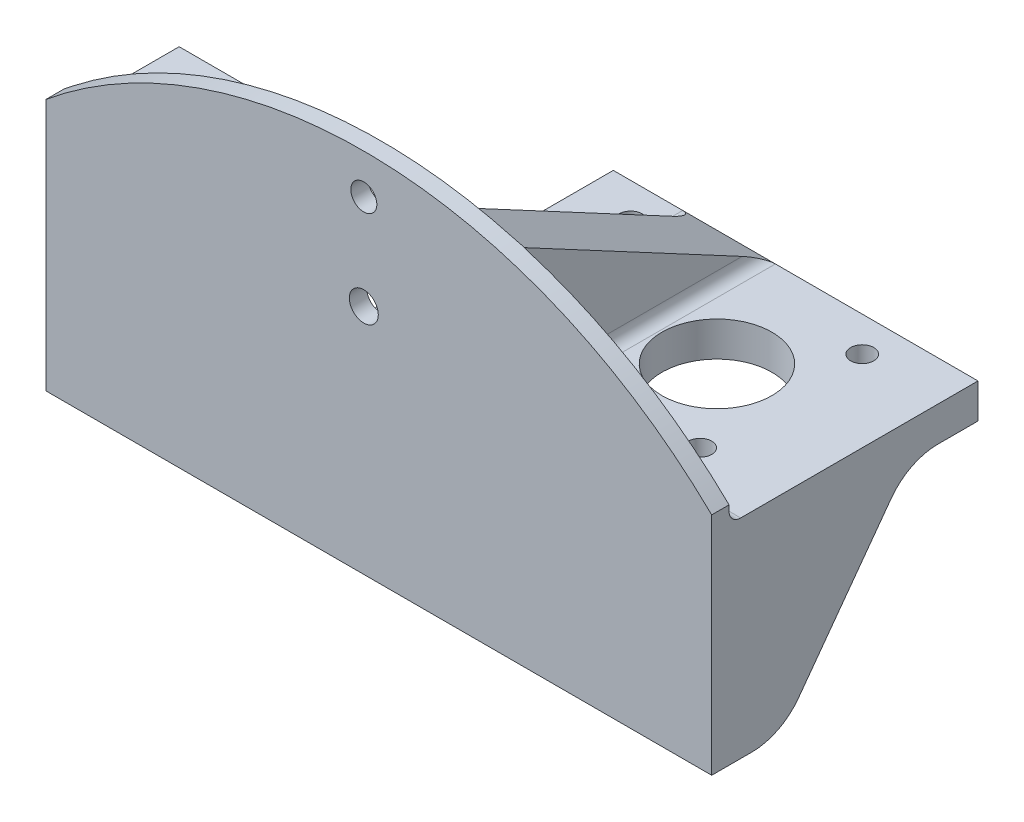
from build123d import *

# Parameters (mm, degrees)
SKETCH2_W                      = 58
SKETCH2_H                      = 40
SKETCH2_R                      = 2
SKETCH2_R_2                    = 9.5
BOSS_EXTRUDE1_DEPTH            = 6
BOSS_EXTRUDE2_DEPTH            = 6
BOSS_EXTRUDE2_DEPTH_BACK       = 30
SKETCH3_W                      = 58
SKETCH3_H                      = 3
BOSS_EXTRUDE4_DEPTH            = 39
BOSS_EXTRUDE4_DEPTH_BACK       = 30
SKETCH7_W                      = 115
SKETCH7_H                      = 3
CUT_EXTRUDE1_DEPTH             = 94.584186698
SKETCH5_R                      = 2.25
SKETCH5_R_2                    = 2.5
CUT_EXTRUDE2_DEPTH             = 92.374080023
BOSS_EXTRUDE3_DEPTH            = 10
BOSS_EXTRUDE3_DEPTH_BACK       = 2
SKETCH8_W                      = 25
SKETCH8_H                      = 40
BOSS_EXTRUDE5_DEPTH            = 20
SKETCH9_R                      = 15.499999921
CUT_EXTRUDE3_DEPTH             = 80.228924642
BOSS_EXTRUDE6_DEPTH            = 5
FILLET2_R                      = 5
CUT_EXTRUDE4_REACH             = 93.374
SKETCH12_W                     = 2
SKETCH12_H                     = 30
CUT_EXTRUDE4_DIRECTION_2_DEPTH = 92.374080176
FILLET1_R                      = 2
FILLET3_R                      = 10


with BuildPart() as part:
    # Sketch2 → Boss-Extrude1 (new body)
    with BuildSketch(Plane(origin=(0, 0, 0), x_dir=(1, 0, 0), z_dir=(0, 1, 0))):
        Rectangle(SKETCH2_W, SKETCH2_H)
        with Locations(Location((-20, 14, 0), (0, 0, 270))):
            Circle(SKETCH2_R, mode=Mode.SUBTRACT)
        with Locations(Location((20, 14, 0), (0, 0, 270))):
            Circle(SKETCH2_R, mode=Mode.SUBTRACT)
        with Locations(Location((20, -14, 0), (0, 0, 270))):
            Circle(SKETCH2_R, mode=Mode.SUBTRACT)
        with Locations(Location((-20, -14, 0), (0, 0, 270))):
            Circle(SKETCH2_R, mode=Mode.SUBTRACT)
        with Locations(Location((8.9, 0, 0), (0, 0, 270))):
            Circle(SKETCH2_R_2, mode=Mode.SUBTRACT)
    extrude(amount=BOSS_EXTRUDE1_DEPTH)

    # Sketch3 → Boss-Extrude2 (add, two sides: drawn at the far end of the back side and taken through both)
    with BuildSketch(Plane(origin=(0, 0, 0), x_dir=(1, 0, 0), z_dir=(0, 1, 0)).offset(-BOSS_EXTRUDE2_DEPTH_BACK)):
        with Locations((0, -21.5)):
            Rectangle(SKETCH3_W, SKETCH3_H)
    extrude(amount=BOSS_EXTRUDE2_DEPTH + BOSS_EXTRUDE2_DEPTH_BACK)

    # Sketch7 → Boss-Extrude4 (add, two sides: drawn at the far end of the back side and taken through both)
    with BuildSketch(Plane(origin=(0, 0, 0), x_dir=(1, 0, 0), z_dir=(0, 1, 0)).offset(-BOSS_EXTRUDE4_DEPTH_BACK)):
        with Locations((-23.5, -24.5)):
            Rectangle(SKETCH7_W, SKETCH7_H)
    extrude(amount=BOSS_EXTRUDE4_DEPTH + BOSS_EXTRUDE4_DEPTH_BACK)

    # Sketch4 → Cut-Extrude1 (cut, through all)
    with BuildSketch(Plane.XY):
        with BuildLine():
            Line((-81, 13.621067419), (-81, 45.200754785))
            Line((-81, 45.200754785), (34, 45.200754785))
            Line((34, 45.200754785), (34, 8.963176429))
            ThreePointArc((34, 8.963176429), (-22.609442943, 33.279339271), (-81, 13.621067419))
        make_face()
    extrude(amount=CUT_EXTRUDE1_DEPTH, mode=Mode.SUBTRACT)

    # Sketch5 → Cut-Extrude2 (cut, through all)
    with BuildSketch(Plane.XY):
        with Locations(Location((-26.099999185, 26.475, 0), (0, 0, 180))):
            Circle(SKETCH5_R)
        with Locations(Location((-26.099999185, 10.1, 0), (0, 0, 180))):
            Circle(SKETCH5_R_2)
    extrude(amount=CUT_EXTRUDE2_DEPTH, mode=Mode.SUBTRACT)

    # Sketch6 → Boss-Extrude3 (add, two sides: drawn at the far end of the back side and taken through both)
    with BuildSketch(Plane(origin=(-13, 0, 0), x_dir=(0, 0, -1), z_dir=(1, 0, 0)).offset(-BOSS_EXTRUDE3_DEPTH_BACK)):
        Polygon((20, 6), (-23, 29), (-23, 6), align=None)
    extrude(amount=BOSS_EXTRUDE3_DEPTH + BOSS_EXTRUDE3_DEPTH_BACK)

    # Sketch8 → Boss-Extrude5 (add)
    with BuildSketch(Plane(origin=(0, 0, 23), x_dir=(-1, 0, 0), z_dir=(0, 0, -1))):
        with Locations((68.5, -10)):
            Rectangle(SKETCH8_W, SKETCH8_H)
    extrude(amount=BOSS_EXTRUDE5_DEPTH)

    # Sketch9 → Cut-Extrude3 (cut, through all)
    with BuildSketch(Plane(origin=(-33, 0, 0), x_dir=(0, 0, -1), z_dir=(1, 0, 0))):
        with Locations((-2.25e-07, -11)):
            Circle(SKETCH9_R)
    extrude(amount=-CUT_EXTRUDE3_DEPTH, mode=Mode.SUBTRACT)

    # Sketch10 → Boss-Extrude6 (add)
    with BuildSketch(Plane(origin=(29, 0, 0), x_dir=(0, 0, -1), z_dir=(1, 0, 0))):
        Polygon((20, 0), (20, 6), (-26, 6), (-26, -30), (-14, -30), (8, 0), align=None)
    extrude(amount=BOSS_EXTRUDE6_DEPTH)

    # Fillet2
    fillet2_edges = [part.edges().sort_by_distance(p)[0] for p in [
        (-68.5, 10, 23),
        (-56, -10, 23),
    ]]
    fillet(fillet2_edges, radius=FILLET2_R)

    # Cut-Extrude4: up to this face of the body (flat: up to its plane)
    cut_extrude4_end = Plane(part.part.faces().sort_by_distance((0, -15, 20))[0])
    # Sketch12 → Cut-Extrude4 (cut, up to the picked face)
    with BuildSketch(Plane.XY, mode=Mode.PRIVATE) as cut_extrude4_sk1:
        with Locations((30, -15)):
            Rectangle(SKETCH12_W, SKETCH12_H)
    cut_extrude4_tool1 = split(extrude(cut_extrude4_sk1.sketch, amount=CUT_EXTRUDE4_REACH, mode=Mode.PRIVATE), bisect_by=cut_extrude4_end, keep=Keep.BOTH, mode=Mode.PRIVATE)
    add(cut_extrude4_tool1.solids().sort_by(Axis((30, -15, 0), (0, 0, 1)))[0], mode=Mode.SUBTRACT)

    # Sketch12 → Cut-Extrude4 direction 2 (cut)
    with BuildSketch(Plane.XY):
        with Locations((30, -15)):
            Rectangle(SKETCH12_W, SKETCH12_H)
    extrude(amount=-CUT_EXTRUDE4_DIRECTION_2_DEPTH, mode=Mode.SUBTRACT)

    # Fillet1
    # the kernel refuses this fillet: 2 mm, written as the material it adds along each edge
    with BuildSketch(Plane(origin=(-1, 8, 21), x_dir=(-1, 0, 0), z_dir=(0, 0, 1))) as fillet1_piece_1_section:
        Polygon((0, 0), (FILLET1_R * 1.02, 0), (FILLET1_R * 1.02, FILLET1_R * 1.02), (0, FILLET1_R * 1.02), align=None)
    fillet1_piece_1 = extrude(amount=FILLET1_R * 1.02, mode=Mode.PRIVATE)
    fillet1_piece_1 = fillet1_piece_1 - Plane(origin=(-1, 8, 21), x_dir=(0.7071067811865475, 0.7071067811865475, 0), z_dir=(0, 0, 1)) * Sphere(FILLET1_R, mode=Mode.PRIVATE)
    add(fillet1_piece_1)
    with BuildSketch(Plane(origin=(-15, 6, 23), x_dir=(0, 1, 0), z_dir=(0, 0, -1))) as fillet1_piece_2_section:
        with BuildLine():
            CenterArc((FILLET1_R, -FILLET1_R), FILLET1_R, 90, 90)
            Line((0, -FILLET1_R), (-FILLET1_R * 0.02, -FILLET1_R))
            Line((-FILLET1_R * 0.02, -FILLET1_R), (-FILLET1_R * 0.02, FILLET1_R * 0.02))
            Line((-FILLET1_R * 0.02, FILLET1_R * 0.02), (FILLET1_R, FILLET1_R * 0.02))
            Line((FILLET1_R, FILLET1_R * 0.02), (FILLET1_R, 0))
        make_face()
    fillet1_piece_2 = extrude(amount=43, mode=Mode.PRIVATE)
    fillet1_piece_2 = split(fillet1_piece_2, bisect_by=Plane(origin=(-15.457624132, 15.214131113, -2.773580962), z_dir=(0, -0.8817846419346917, 0.47165225033716063)), keep=Keep.TOP, mode=Mode.PRIVATE)
    add(fillet1_piece_2)
    with BuildSketch(Plane(origin=(-3, 6, 21), x_dir=(0, 1, 0), z_dir=(0, 0, -1))) as fillet1_piece_3_section:
        with BuildLine():
            CenterArc((FILLET1_R, FILLET1_R), FILLET1_R, 180, 90)
            Line((0, FILLET1_R), (-FILLET1_R * 0.02, FILLET1_R))
            Line((-FILLET1_R * 0.02, FILLET1_R), (-FILLET1_R * 0.02, -FILLET1_R * 0.02))
            Line((-FILLET1_R * 0.02, -FILLET1_R * 0.02), (FILLET1_R, -FILLET1_R * 0.02))
            Line((FILLET1_R, -FILLET1_R * 0.02), (FILLET1_R, 0))
        make_face()
    fillet1_piece_3 = extrude(amount=41, mode=Mode.PRIVATE)
    fillet1_piece_3 = split(fillet1_piece_3, bisect_by=Plane(origin=(-2.542135078, 14.797986004, -3.551591383), z_dir=(0, -0.8817846419346917, 0.47165225033716063)), keep=Keep.TOP, mode=Mode.PRIVATE)
    add(fillet1_piece_3)
    with BuildSketch(Plane(origin=(-3, 34, 23), x_dir=(1, 0, 0), z_dir=(0, -1, 0))) as fillet1_piece_4_section:
        with BuildLine():
            CenterArc((FILLET1_R, -FILLET1_R), FILLET1_R, 90, 90)
            Line((0, -FILLET1_R), (-FILLET1_R * 0.02, -FILLET1_R))
            Line((-FILLET1_R * 0.02, -FILLET1_R), (-FILLET1_R * 0.02, FILLET1_R * 0.02))
            Line((-FILLET1_R * 0.02, FILLET1_R * 0.02), (FILLET1_R, FILLET1_R * 0.02))
            Line((FILLET1_R, FILLET1_R * 0.02), (FILLET1_R, 0))
        make_face()
    fillet1_piece_4 = extrude(amount=26, mode=Mode.PRIVATE)
    fillet1_piece_4 = split(fillet1_piece_4, bisect_by=Plane(origin=(-2.544379772, 26.451239118, 18.234925307), z_dir=(0, -0.8817846419346917, 0.47165225033716063)), keep=Keep.TOP, mode=Mode.PRIVATE)
    add(fillet1_piece_4)
    with BuildSketch(Plane(origin=(34, 6, 23), x_dir=(0, 1, 0), z_dir=(-1, 0, 0))) as fillet1_piece_5:
        with BuildLine():
            CenterArc((FILLET1_R, FILLET1_R), FILLET1_R, 180, 90)
            Line((0, FILLET1_R), (-FILLET1_R * 0.02, FILLET1_R))
            Line((-FILLET1_R * 0.02, FILLET1_R), (-FILLET1_R * 0.02, -FILLET1_R * 0.02))
            Line((-FILLET1_R * 0.02, -FILLET1_R * 0.02), (FILLET1_R, -FILLET1_R * 0.02))
            Line((FILLET1_R, -FILLET1_R * 0.02), (FILLET1_R, 0))
        make_face()
    extrude(amount=35)
    with BuildSketch(Plane(origin=(-15, 34, 23), x_dir=(-1, 0, 0), z_dir=(0, -1, 0))) as fillet1_piece_6_section:
        with BuildLine():
            CenterArc((FILLET1_R, FILLET1_R), FILLET1_R, 180, 90)
            Line((0, FILLET1_R), (-FILLET1_R * 0.02, FILLET1_R))
            Line((-FILLET1_R * 0.02, FILLET1_R), (-FILLET1_R * 0.02, -FILLET1_R * 0.02))
            Line((-FILLET1_R * 0.02, -FILLET1_R * 0.02), (FILLET1_R, -FILLET1_R * 0.02))
            Line((FILLET1_R, -FILLET1_R * 0.02), (FILLET1_R, 0))
        make_face()
    fillet1_piece_6 = extrude(amount=28, mode=Mode.PRIVATE)
    fillet1_piece_6 = split(fillet1_piece_6, bisect_by=Plane(origin=(-15.455371522, 26.228583138, 17.818655432), z_dir=(0, -0.8817846419346917, 0.47165225033716063)), keep=Keep.TOP, mode=Mode.PRIVATE)
    add(fillet1_piece_6)
    with BuildSketch(Plane(origin=(-29, -30, 23), x_dir=(-1, 0, 0), z_dir=(0, 1, 0))) as fillet1_piece_7:
        with BuildLine():
            CenterArc((FILLET1_R, -FILLET1_R), FILLET1_R, 90, 90)
            Line((0, -FILLET1_R), (-FILLET1_R * 0.02, -FILLET1_R))
            Line((-FILLET1_R * 0.02, -FILLET1_R), (-FILLET1_R * 0.02, FILLET1_R * 0.02))
            Line((-FILLET1_R * 0.02, FILLET1_R * 0.02), (FILLET1_R, FILLET1_R * 0.02))
            Line((FILLET1_R, FILLET1_R * 0.02), (FILLET1_R, 0))
        make_face()
    extrude(amount=36)
    with BuildSketch(Plane(origin=(-15, 29, 23), x_dir=(0, 1, 0), z_dir=(1, 0, 0))) as fillet1_piece_8:
        with BuildLine():
            CenterArc((FILLET1_R * 0.59918003165, -FILLET1_R), FILLET1_R, 90, 61.858398768)
            Line((-FILLET1_R * 0.282604610285, -FILLET1_R * 0.528347749663), (-FILLET1_R * 0.300240303123, -FILLET1_R * 0.518914704656))
            Line((-FILLET1_R * 0.300240303123, -FILLET1_R * 0.518914704656), (-FILLET1_R * 0.011983600633, FILLET1_R * 0.02))
            Line((-FILLET1_R * 0.011983600633, FILLET1_R * 0.02), (FILLET1_R * 0.59918003165, FILLET1_R * 0.02))
            Line((FILLET1_R * 0.59918003165, FILLET1_R * 0.02), (FILLET1_R * 0.59918003165, 0))
        make_face()
    extrude(amount=12)
    with BuildSketch(Plane(origin=(-15, 34, 23), x_dir=(-1, 0, 0), z_dir=(0, -1, 0))) as fillet1_piece_9a_section:
        with BuildLine():
            CenterArc((FILLET1_R, FILLET1_R), FILLET1_R, 180, 90)
            Line((0, FILLET1_R), (-FILLET1_R * 0.02, FILLET1_R))
            Line((-FILLET1_R * 0.02, FILLET1_R), (-FILLET1_R * 0.02, -FILLET1_R * 0.02))
            Line((-FILLET1_R * 0.02, -FILLET1_R * 0.02), (FILLET1_R, -FILLET1_R * 0.02))
            Line((FILLET1_R, -FILLET1_R * 0.02), (FILLET1_R, 0))
        make_face()
    fillet1_piece_9a = extrude(amount=33, mode=Mode.PRIVATE)
    fillet1_piece_9a = split(fillet1_piece_9a, bisect_by=Plane(origin=(-15.452790229, 6, 22.547209771), z_dir=(0, -1, 0)), keep=Keep.TOP, mode=Mode.PRIVATE)
    with BuildSketch(Plane(origin=(-15, 6, 28), x_dir=(0, 1, 0), z_dir=(0, 0, -1))) as fillet1_piece_9b_section:
        with BuildLine():
            CenterArc((FILLET1_R, -FILLET1_R), FILLET1_R, 90, 90)
            Line((0, -FILLET1_R), (-FILLET1_R * 0.02, -FILLET1_R))
            Line((-FILLET1_R * 0.02, -FILLET1_R), (-FILLET1_R * 0.02, FILLET1_R * 0.02))
            Line((-FILLET1_R * 0.02, FILLET1_R * 0.02), (FILLET1_R, FILLET1_R * 0.02))
            Line((FILLET1_R, FILLET1_R * 0.02), (FILLET1_R, 0))
        make_face()
    fillet1_piece_9b = extrude(amount=48, mode=Mode.PRIVATE)
    fillet1_piece_9b = split(fillet1_piece_9b, bisect_by=Plane(origin=(-15.452790229, 6.452790229, 23), z_dir=(0, 0, 1)), keep=Keep.TOP, mode=Mode.PRIVATE)
    fillet1_piece_9 = fillet1_piece_9a & fillet1_piece_9b
    add(fillet1_piece_9)
    with BuildSketch(Plane(origin=(-15, 29, 23), x_dir=(0, 1, 0), z_dir=(1, 0, 0))) as fillet1_piece_10a_section:
        with BuildLine():
            CenterArc((FILLET1_R * 0.59918003165, -FILLET1_R), FILLET1_R, 90, 61.858398768)
            Line((-FILLET1_R * 0.282604610285, -FILLET1_R * 0.528347749663), (-FILLET1_R * 0.300240303123, -FILLET1_R * 0.518914704656))
            Line((-FILLET1_R * 0.300240303123, -FILLET1_R * 0.518914704656), (-FILLET1_R * 0.011983600633, FILLET1_R * 0.02))
            Line((-FILLET1_R * 0.011983600633, FILLET1_R * 0.02), (FILLET1_R * 0.59918003165, FILLET1_R * 0.02))
            Line((FILLET1_R * 0.59918003165, FILLET1_R * 0.02), (FILLET1_R * 0.59918003165, 0))
        make_face()
    fillet1_piece_10a = extrude(amount=14.995900158, mode=Mode.PRIVATE)
    fillet1_piece_10a = fillet1_piece_10a & Plane(origin=(-26.099999185, -52.9, 22.74718016), x_dir=(0.6968115847591843, 0.717254219468519, 0), z_dir=(0, 0, -1)) * Cylinder(86.25, 35, mode=Mode.PRIVATE)
    fillet1_piece_10a = split(fillet1_piece_10a, bisect_by=Plane(origin=(-3, 29.068183889, 22.74718016), z_dir=(1, 0, 0)), keep=Keep.TOP, mode=Mode.PRIVATE)
    with BuildSketch(Plane(origin=(-3, 34, 23), x_dir=(1, 0, 0), z_dir=(0, -1, 0))) as fillet1_piece_10b_section:
        with BuildLine():
            CenterArc((FILLET1_R, -FILLET1_R), FILLET1_R, 90, 90)
            Line((0, -FILLET1_R), (-FILLET1_R * 0.02, -FILLET1_R))
            Line((-FILLET1_R * 0.02, -FILLET1_R), (-FILLET1_R * 0.02, FILLET1_R * 0.02))
            Line((-FILLET1_R * 0.02, FILLET1_R * 0.02), (FILLET1_R, FILLET1_R * 0.02))
            Line((FILLET1_R, FILLET1_R * 0.02), (FILLET1_R, 0))
        make_face()
    fillet1_piece_10b = extrude(amount=26, mode=Mode.PRIVATE)
    fillet1_piece_10b = fillet1_piece_10b & Plane(origin=(-26.099999185, -52.9, 22.447570128), x_dir=(0.6968115847591843, 0.717254219468519, 0), z_dir=(0, 0, -1)) * Cylinder(86.25, 60, mode=Mode.PRIVATE)
    fillet1_piece_10b = split(fillet1_piece_10b, bisect_by=Plane(origin=(-2.632601373, 28.859185521, 22.736738149), z_dir=(0, 0.8817846419346917, -0.47165225033716063)), keep=Keep.TOP, mode=Mode.PRIVATE)
    fillet1_piece_10 = fillet1_piece_10a & fillet1_piece_10b
    add(fillet1_piece_10)
    with BuildSketch(Plane(origin=(-15, 34, 23), x_dir=(-1, 0, 0), z_dir=(0, -1, 0))) as fillet1_piece_11a_section:
        with BuildLine():
            CenterArc((FILLET1_R, FILLET1_R), FILLET1_R, 180, 90)
            Line((0, FILLET1_R), (-FILLET1_R * 0.02, FILLET1_R))
            Line((-FILLET1_R * 0.02, FILLET1_R), (-FILLET1_R * 0.02, -FILLET1_R * 0.02))
            Line((-FILLET1_R * 0.02, -FILLET1_R * 0.02), (FILLET1_R, -FILLET1_R * 0.02))
            Line((FILLET1_R, -FILLET1_R * 0.02), (FILLET1_R, 0))
        make_face()
    fillet1_piece_11a = extrude(amount=28, mode=Mode.PRIVATE)
    fillet1_piece_11a = fillet1_piece_11a & Plane(origin=(-26.099999185, -52.9, 22.525345576), x_dir=(0.6968115847591843, 0.717254219468519, 0), z_dir=(0, 0, -1)) * Cylinder(86.25, 64, mode=Mode.PRIVATE)
    fillet1_piece_11a = split(fillet1_piece_11a, bisect_by=Plane(origin=(-15.443593733, 29.184571459, 23.34506838), z_dir=(0, 0.8817846419346917, -0.47165225033716063)), keep=Keep.TOP, mode=Mode.PRIVATE)
    with BuildSketch(Plane(origin=(-17.995900158, 29, 23), x_dir=(0, 1, 0), z_dir=(1, 0, 0))) as fillet1_piece_11b_section:
        with BuildLine():
            CenterArc((FILLET1_R * 0.59918003165, -FILLET1_R), FILLET1_R, 90, 61.858398768)
            Line((-FILLET1_R * 0.282604610285, -FILLET1_R * 0.528347749663), (-FILLET1_R * 0.300240303123, -FILLET1_R * 0.518914704656))
            Line((-FILLET1_R * 0.300240303123, -FILLET1_R * 0.518914704656), (-FILLET1_R * 0.011983600633, FILLET1_R * 0.02))
            Line((-FILLET1_R * 0.011983600633, FILLET1_R * 0.02), (FILLET1_R * 0.59918003165, FILLET1_R * 0.02))
            Line((FILLET1_R * 0.59918003165, FILLET1_R * 0.02), (FILLET1_R * 0.59918003165, 0))
        make_face()
    fillet1_piece_11b = extrude(amount=14.995900158, mode=Mode.PRIVATE)
    fillet1_piece_11b = split(fillet1_piece_11b, bisect_by=Plane(origin=(-15, 29.137483158, 22.770547831), z_dir=(-1, 0, 0)), keep=Keep.TOP, mode=Mode.PRIVATE)
    fillet1_piece_11 = fillet1_piece_11a & fillet1_piece_11b
    add(fillet1_piece_11)

    # Fillet3
    fillet3_edges = [part.edges().sort_by_distance(p)[0] for p in [
        (32.5, 0, -8),
        (32.5, -30, 14),
    ]]
    fillet(fillet3_edges, radius=FILLET3_R)


solid = part.part
